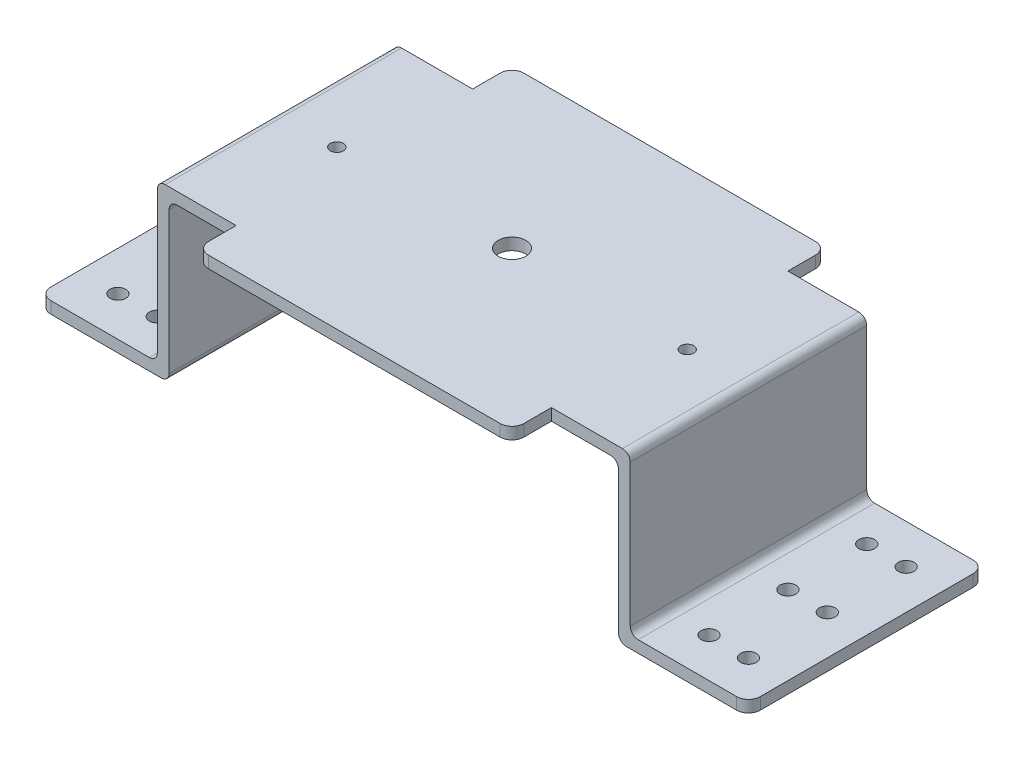
from build123d import *

# Parameters (mm, degrees)
SKETCH_1_W                  = 120
SKETCH_1_H                  = 60
EXTRUDE_1_DEPTH             = 3
SKETCH_2_W                  = 3
SKETCH_2_H                  = 60
EXTRUDE_2_DEPTH             = 40
SKETCH_3_W                  = 60
SKETCH_3_H                  = 3
EXTRUDE_3_DEPTH             = 30
SKETCH_4_R                  = 2
CUT_EXTRUDE_1_DEPTH         = 3
PATTERN_LINEAR_1_COUNT      = 3
PATTERN_LINEAR_1_PITCH      = 20
PATTERN_LINEAR_1_COUNT_DIR2 = 2
PATTERN_LINEAR_1_PITCH_DIR2 = 10
MIRROR_1_COPY_1_SKETCH_R    = 2
MIRROR_1_COPY_1_DEPTH       = 3
MIRROR_1_COPY_2_SKETCH_R    = 2
MIRROR_1_COPY_2_DEPTH       = 3
MIRROR_1_COPY_3_SKETCH_R    = 2
MIRROR_1_COPY_3_DEPTH       = 3
MIRROR_1_COPY_4_SKETCH_R    = 2
MIRROR_1_COPY_4_DEPTH       = 3
MIRROR_1_COPY_5_SKETCH_R    = 2
MIRROR_1_COPY_5_DEPTH       = 3
MIRROR_1_COPY_6_SKETCH_R    = 2
MIRROR_1_COPY_6_DEPTH       = 3
SKETCH_5_R                  = 3.5
CUT_EXTRUDE_2_DEPTH         = 3
SKETCH_6_R                  = 1.5
CUT_EXTRUDE_3_DEPTH         = 3
SKETCH_7_W                  = 80
SKETCH_7_H                  = 10
EXTRUDE_4_DEPTH             = 3
FILLET_1_R                  = 3
FILLET_2_R                  = 3
FILLET_3_R                  = 2
FILLET_4_R                  = 2
FILLET_5_R                  = 3
HOLE_WIZARD_M4_1_D          = 3.3


with BuildPart() as part:
    # 草图1 → 凸台-拉伸1 (new body)
    with BuildSketch(Plane(origin=(0, 0, 0), x_dir=(1, 0, 0), z_dir=(0, 1, 0))):
        Rectangle(SKETCH_1_W, SKETCH_1_H)
    extrude(amount=EXTRUDE_1_DEPTH)

    # 草图2 → 凸台-拉伸2 (add)
    with BuildSketch(Plane.XZ):
        with Locations((-58.5, 0)):
            Rectangle(SKETCH_2_W, SKETCH_2_H)
    extrude_2 = extrude(amount=EXTRUDE_2_DEPTH)

    # 草图3 → 凸台-拉伸3 (add)
    with BuildSketch(Plane.ZY.offset(60)):
        with Locations((0, -38.5)):
            Rectangle(SKETCH_3_W, SKETCH_3_H)
    extrude_3 = extrude(amount=EXTRUDE_3_DEPTH)

    # 草图4 → 切除-拉伸1 (cut)
    with BuildSketch(Plane(origin=(0, -37, 0), x_dir=(1, 0, 0), z_dir=(0, 1, 0))):
        with Locations((-70, -20)):
            Circle(SKETCH_4_R)
    cut_extrude_1 = extrude(amount=-CUT_EXTRUDE_1_DEPTH, mode=Mode.SUBTRACT)

    # 阵列(线性)1: Cut-Extrude 1 3 × 2
    with Locations(*[(-j * PATTERN_LINEAR_1_PITCH_DIR2, 0, -i * PATTERN_LINEAR_1_PITCH) for i in range(PATTERN_LINEAR_1_COUNT) for j in range(PATTERN_LINEAR_1_COUNT_DIR2) if (i, j) != (0, 0)]):
        add(cut_extrude_1, mode=Mode.SUBTRACT)

    # 镜向1: 凸台-拉伸2, 凸台-拉伸3 across plane
    add(extrude_2.mirror(Plane(origin=(0, 0, 0), x_dir=(0, 0, 1), z_dir=(1, 0, 0))))
    add(extrude_3.mirror(Plane(origin=(0, 0, 0), x_dir=(0, 0, 1), z_dir=(1, 0, 0))))

    # 镜向1 copy 1 sketch → 镜向1 copy 1 (cut)
    with BuildSketch(Plane(origin=(10, -37, 0), x_dir=(-1, 0, 0), z_dir=(0, 1, 0))):
        with Locations((-70, 20)):
            Circle(MIRROR_1_COPY_1_SKETCH_R)
    extrude(amount=-MIRROR_1_COPY_1_DEPTH, mode=Mode.SUBTRACT)

    # 镜向1 copy 2 sketch → 镜向1 copy 2 (cut)
    with BuildSketch(Plane(origin=(0, -37, -20), x_dir=(-1, 0, 0), z_dir=(0, 1, 0))):
        with Locations((-70, 20)):
            Circle(MIRROR_1_COPY_2_SKETCH_R)
    extrude(amount=-MIRROR_1_COPY_2_DEPTH, mode=Mode.SUBTRACT)

    # 镜向1 copy 3 sketch → 镜向1 copy 3 (cut)
    with BuildSketch(Plane(origin=(10, -37, -20), x_dir=(-1, 0, 0), z_dir=(0, 1, 0))):
        with Locations((-70, 20)):
            Circle(MIRROR_1_COPY_3_SKETCH_R)
    extrude(amount=-MIRROR_1_COPY_3_DEPTH, mode=Mode.SUBTRACT)

    # 镜向1 copy 4 sketch → 镜向1 copy 4 (cut)
    with BuildSketch(Plane(origin=(0, -37, -40), x_dir=(-1, 0, 0), z_dir=(0, 1, 0))):
        with Locations((-70, 20)):
            Circle(MIRROR_1_COPY_4_SKETCH_R)
    extrude(amount=-MIRROR_1_COPY_4_DEPTH, mode=Mode.SUBTRACT)

    # 镜向1 copy 5 sketch → 镜向1 copy 5 (cut)
    with BuildSketch(Plane(origin=(10, -37, -40), x_dir=(-1, 0, 0), z_dir=(0, 1, 0))):
        with Locations((-70, 20)):
            Circle(MIRROR_1_COPY_5_SKETCH_R)
    extrude(amount=-MIRROR_1_COPY_5_DEPTH, mode=Mode.SUBTRACT)

    # 镜向1 copy 6 sketch → 镜向1 copy 6 (cut)
    with BuildSketch(Plane(origin=(0, -37, 0), x_dir=(-1, 0, 0), z_dir=(0, 1, 0))):
        with Locations((-70, 20)):
            Circle(MIRROR_1_COPY_6_SKETCH_R)
    extrude(amount=-MIRROR_1_COPY_6_DEPTH, mode=Mode.SUBTRACT)

    # 草图5 → 切除-拉伸2 (cut)
    with BuildSketch(Plane(origin=(0, 3, 0), x_dir=(1, 0, 0), z_dir=(0, 1, 0))):
        Circle(SKETCH_5_R)
    extrude(amount=-CUT_EXTRUDE_2_DEPTH, mode=Mode.SUBTRACT)

    # 草图6 → 切除-拉伸3 (cut)
    with BuildSketch(Plane(origin=(0, 3, 0), x_dir=(1, 0, 0), z_dir=(0, 1, 0))):
        with Locations((44.45, 0)):
            Circle(SKETCH_6_R)
    cut_extrude_3 = extrude(amount=-CUT_EXTRUDE_3_DEPTH, mode=Mode.SUBTRACT)

    # 镜向2: 切除-拉伸3 across plane
    add(cut_extrude_3.mirror(Plane(origin=(0, 0, 0), x_dir=(0, 0, 1), z_dir=(1, 0, 0))), mode=Mode.SUBTRACT)

    # 草图7 → 凸台-拉伸4 (add)
    with BuildSketch(Plane(origin=(0, 3, 0), x_dir=(1, 0, 0), z_dir=(0, 1, 0))):
        with Locations((0, 35)):
            Rectangle(SKETCH_7_W, SKETCH_7_H)
    extrude_4 = extrude(amount=-EXTRUDE_4_DEPTH)

    # 镜向3: 凸台-拉伸4 across plane
    add(extrude_4.mirror(Plane.XY))

    # 圆角1
    fillet_1_edges = [part.edges().sort_by_distance(p)[0] for p in [
        (-40, 1.5, 40),
    ]]
    fillet(fillet_1_edges, radius=FILLET_1_R)

    # 圆角2
    fillet_2_edges = [part.edges().sort_by_distance(p)[0] for p in [
        (40, 1.5, 40),
        (40, 1.5, -40),
        (-40, 1.5, -40),
    ]]
    fillet(fillet_2_edges, radius=FILLET_2_R)

    # 圆角3
    fillet_3_edges = [part.edges().sort_by_distance(p)[0] for p in [
        (-57, 0, 0),
        (-60, 3, 0),
    ]]
    fillet(fillet_3_edges, radius=FILLET_3_R)

    # 圆角4
    fillet_4_edges = [part.edges().sort_by_distance(p)[0] for p in [
        (-57, -40, 0),
        (-60, -37, 0),
        (60, -37, 0),
        (57, -40, 0),
        (57, 0, 0),
        (60, 3, 0),
    ]]
    fillet(fillet_4_edges, radius=FILLET_4_R)

    # 圆角5
    fillet_5_edges = [part.edges().sort_by_distance(p)[0] for p in [
        (90, -38.5, -30),
        (90, -38.5, 30),
        (-90, -38.5, -30),
        (-90, -38.5, 30),
    ]]
    fillet(fillet_5_edges, radius=FILLET_5_R)

    # M4 螺纹孔1 (through all)
    with Locations(Plane(origin=(0, 3, 0), x_dir=(1, 0, 0), z_dir=(0, 1, 0))):
        with Locations((44.45, 0), (-44.45, 0)):
            Hole(HOLE_WIZARD_M4_1_D / 2)


solid = part.part
